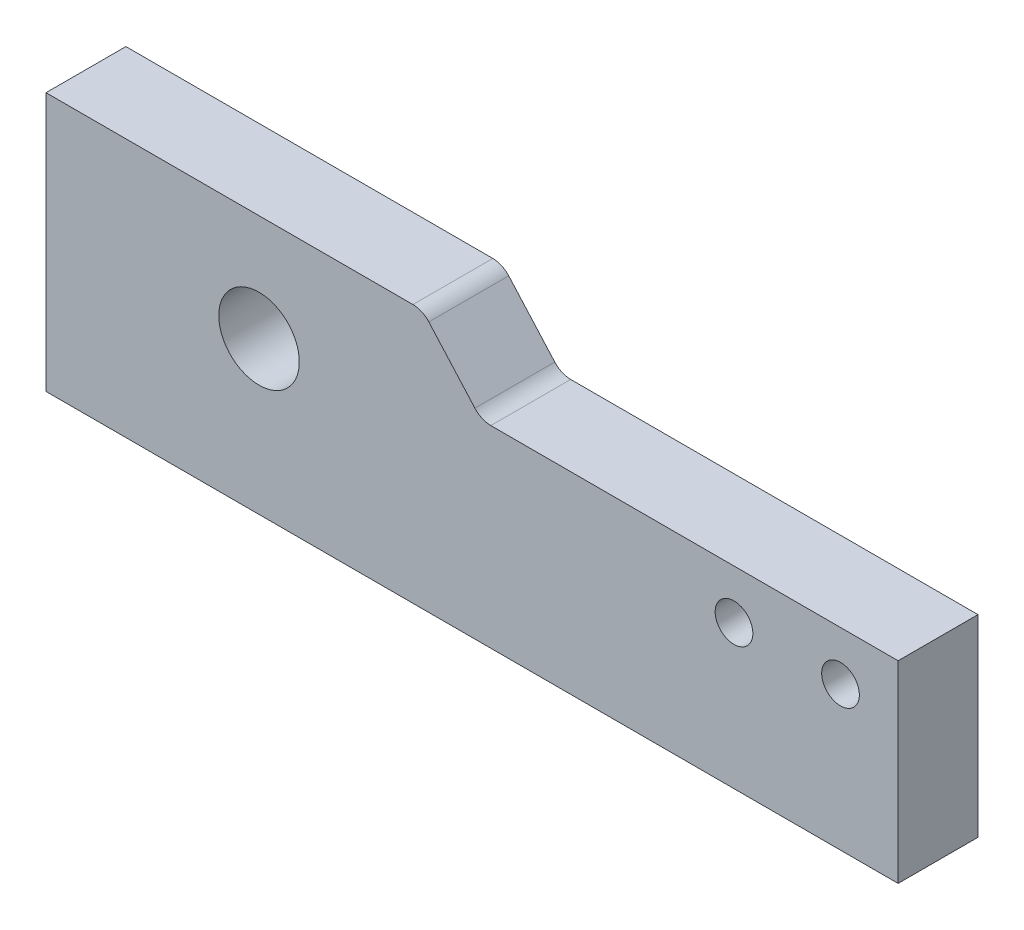
from build123d import *

# Parameters (mm, degrees)
BOSS_EXTRUDE1_DEPTH   = 9.525
SKETCH6_R             = 4.800000000000002
CUT_EXTRUDE1_DEPTH    = 57.261143340675204
SKETCH10_R            = 2.2859999999999947
CUT_EXTRUDE2_DEPTH    = 3.8099999999999996
F_8_CLEARANCE_HOLE1_D = 4.4958
SKETCH13_W            = 109.6136957213275
SKETCH13_H            = 27.196963560799638
CUT_EXTRUDE3_DEPTH    = 57.261143340675204
CUT_EXTRUDE5_DEPTH    = 57.2611433406752
FILLET1_R             = 2.54


with BuildPart() as part:
    # Sketch1 → Boss-Extrude1 (new body)
    with BuildSketch(Plane.XY):
        Polygon((50.79999999999998, -22.225), (-50.800000000000004, -22.225000000000012), (-50.800000000000004, 22.224999999999984), (50.79999999999999, 22.224999999999998), align=None)
    extrude(amount=BOSS_EXTRUDE1_DEPTH)

    # Sketch6 → Cut-Extrude1 (cut, through all)
    with BuildSketch(Plane.XY):
        with Locations((-25.4, 9.524999999999999)):
            Circle(SKETCH6_R)
    extrude(amount=CUT_EXTRUDE1_DEPTH, mode=Mode.SUBTRACT)

    # Sketch10 → Cut-Extrude2 (cut)
    with BuildSketch(Plane.XY.offset(9.525)):
        with Locations((-46.11545283004946, -16.76399999999999)):
            Circle(SKETCH10_R)
    extrude(amount=-CUT_EXTRUDE2_DEPTH, mode=Mode.SUBTRACT)

    # #8 Clearance Hole1 (through all)
    with Locations(Plane(origin=(0, 0, 0), x_dir=(-1, 0, 0), z_dir=(0, 0, -1))):
        with Locations((-43.931814057, 8.51848178), (-31.231814057, 8.51848178)):
            Hole(F_8_CLEARANCE_HOLE1_D / 2)

    # Sketch13 → Cut-Extrude3 (cut, through all)
    with BuildSketch(Plane(origin=(0, 0, 0), x_dir=(-1, 0, 0), z_dir=(0, 0, -1))):
        with Locations((0, -22.225000000072345)):
            Rectangle(SKETCH13_W, SKETCH13_H)
    extrude(amount=-CUT_EXTRUDE3_DEPTH, mode=Mode.SUBTRACT)

    # Sketch14 → Cut-Extrude5 (cut, through all)
    with BuildSketch(Plane(origin=(0, 0, 0), x_dir=(-1, 0, 0), z_dir=(0, 0, -1))):
        Polygon((-50.80000000007075, 14.368885078592964), (-1.0960952551413707, 14.368885078592964), (-0.33859307620571544, 15.218043280381785), (6.4513217163673575, 22.82952215911174), (6.4513217163673575, 26.369267610296045), (-61.117569834071936, 26.369267610296045), (-61.117569834071936, 13.29236417327235), align=None)
    extrude(amount=-CUT_EXTRUDE5_DEPTH, mode=Mode.SUBTRACT)

    # Fillet1
    fillet1_edges = [part.edges().sort_by_distance(p)[0] for p in [
        (-5.912050174530525, 22.22499999999999, 4.7625),
        (1.0960952551413707, 14.368885078592964, 4.7625),
    ]]
    fillet(fillet1_edges, radius=FILLET1_R)


solid = part.part
